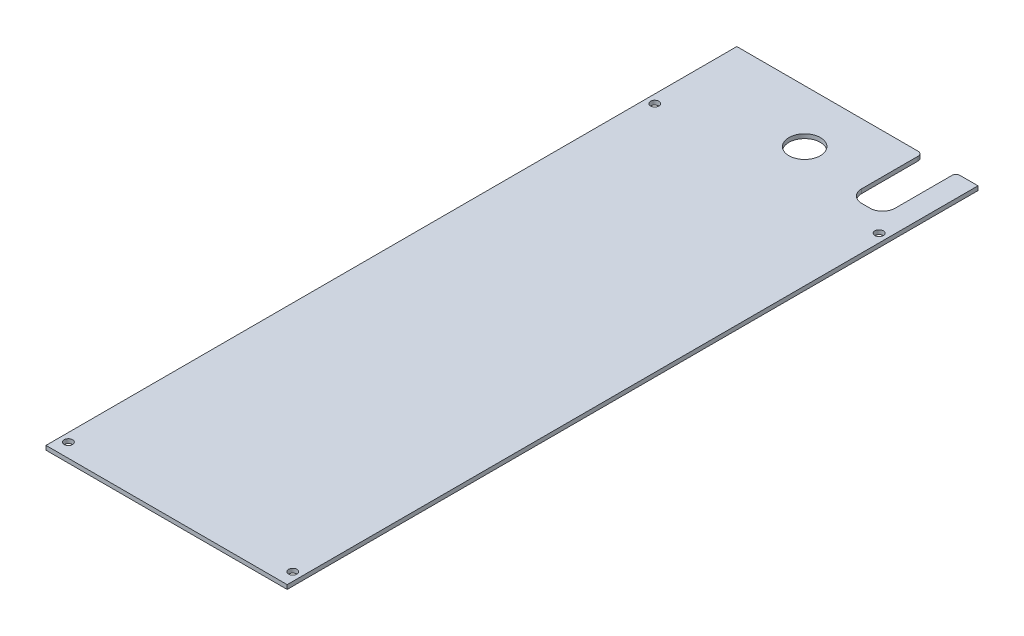
from build123d import *

# Parameters (mm, degrees)
CROQUIS12_W           = 115
CROQUIS12_H           = 329.4
BRIDA_BASE2_DEPTH     = 2
CORTAR_EXTRUIR6_REACH = 217.801
CROQUIS27_R           = 2
CORTAR_EXTRUIR7_REACH = 217.801
CROQUIS28_R           = 7.5
CROQUIS29_W           = 16
CROQUIS29_H           = 35
CORTAR_EXTRUIR8_DEPTH = 216.801042861
REDONDEO1_R           = 6
REDONDEO2_R           = 2


# Sheet-metal steps are written as plain solids
with BuildPart() as part:
    # Croquis12 → Brida base2 (new body)
    with BuildSketch(Plane(origin=(0, 0, 0), x_dir=(1, 0, 0), z_dir=(0, 1, 0))):
        with Locations((0, -43.29)):
            Rectangle(CROQUIS12_W, CROQUIS12_H)
    extrude(amount=-BRIDA_BASE2_DEPTH)

    # Croquis27 → Cortar-Extruir6 (cut, up to next)
    with BuildSketch(Plane(origin=(0, 0, 0), x_dir=(1, 0, 0), z_dir=(0, 1, 0)), mode=Mode.PRIVATE) as cortar_extruir6_sk1:
        with Locations(Location((-53.5, -201.3, 0), (0, 0, 270))):
            Circle(CROQUIS27_R)
    cortar_extruir6_tool1 = extrude(cortar_extruir6_sk1.sketch, amount=-CORTAR_EXTRUIR6_REACH, mode=Mode.PRIVATE) & part.part
    # Croquis27 → Cortar-Extruir6 (cut, up to next)
    with BuildSketch(Plane(origin=(0, 0, 0), x_dir=(1, 0, 0), z_dir=(0, 1, 0)), mode=Mode.PRIVATE) as cortar_extruir6_sk2:
        with Locations(Location((-53.5, 78.26, 0), (0, 0, 270))):
            Circle(CROQUIS27_R)
    cortar_extruir6_tool2 = extrude(cortar_extruir6_sk2.sketch, amount=-CORTAR_EXTRUIR6_REACH, mode=Mode.PRIVATE) & part.part
    # Croquis27 → Cortar-Extruir6 (cut, up to next)
    with BuildSketch(Plane(origin=(0, 0, 0), x_dir=(1, 0, 0), z_dir=(0, 1, 0)), mode=Mode.PRIVATE) as cortar_extruir6_sk3:
        with Locations(Location((53.5, 78.26, 0), (0, 0, 90))):
            Circle(CROQUIS27_R)
    cortar_extruir6_tool3 = extrude(cortar_extruir6_sk3.sketch, amount=-CORTAR_EXTRUIR6_REACH, mode=Mode.PRIVATE) & part.part
    # Croquis27 → Cortar-Extruir6 (cut, up to next)
    with BuildSketch(Plane(origin=(0, 0, 0), x_dir=(1, 0, 0), z_dir=(0, 1, 0)), mode=Mode.PRIVATE) as cortar_extruir6_sk4:
        with Locations(Location((53.5, -201.3, 0), (0, 0, 90))):
            Circle(CROQUIS27_R)
    cortar_extruir6_tool4 = extrude(cortar_extruir6_sk4.sketch, amount=-CORTAR_EXTRUIR6_REACH, mode=Mode.PRIVATE) & part.part
    add(cortar_extruir6_tool1.solids().sort_by_distance((-53.5, 0, 201.3))[0], mode=Mode.SUBTRACT)
    add(cortar_extruir6_tool2.solids().sort_by_distance((-53.5, 0, -78.26))[0], mode=Mode.SUBTRACT)
    add(cortar_extruir6_tool3.solids().sort_by_distance((53.5, 0, -78.26))[0], mode=Mode.SUBTRACT)
    add(cortar_extruir6_tool4.solids().sort_by_distance((53.5, 0, 201.3))[0], mode=Mode.SUBTRACT)

    # Croquis28 → Cortar-Extruir7 (cut, up to next)
    with BuildSketch(Plane(origin=(0, 0, 0), x_dir=(1, 0, 0), z_dir=(0, 1, 0)), mode=Mode.PRIVATE) as cortar_extruir7_sk1:
        with Locations(Location((0, 96.25, 0), (0, 0, 270))):
            Circle(CROQUIS28_R)
    cortar_extruir7_tool1 = extrude(cortar_extruir7_sk1.sketch, amount=-CORTAR_EXTRUIR7_REACH, mode=Mode.PRIVATE) & part.part
    add(cortar_extruir7_tool1.solids().sort_by_distance((0, 0, -96.25))[0], mode=Mode.SUBTRACT)

    # Croquis29 → Cortar-Extruir8 (cut, through all)
    with BuildSketch(Plane(origin=(0, 0, 0), x_dir=(1, 0, 0), z_dir=(0, 1, 0))):
        with Locations((39, 103.91)):
            Rectangle(CROQUIS29_W, CROQUIS29_H)
    extrude(amount=-CORTAR_EXTRUIR8_DEPTH, mode=Mode.SUBTRACT)

    # Redondeo1
    redondeo1_edges = [part.edges().sort_by_distance(p)[0] for p in [
        (31, -1, -86.41),
        (47, -1, -86.41),
    ]]
    fillet(redondeo1_edges, radius=REDONDEO1_R)

    # Redondeo2
    redondeo2_edges = [part.edges().sort_by_distance(p)[0] for p in [
        (31, -1, -121.41),
        (47, -1, -121.41),
    ]]
    fillet(redondeo2_edges, radius=REDONDEO2_R)


solid = part.part
